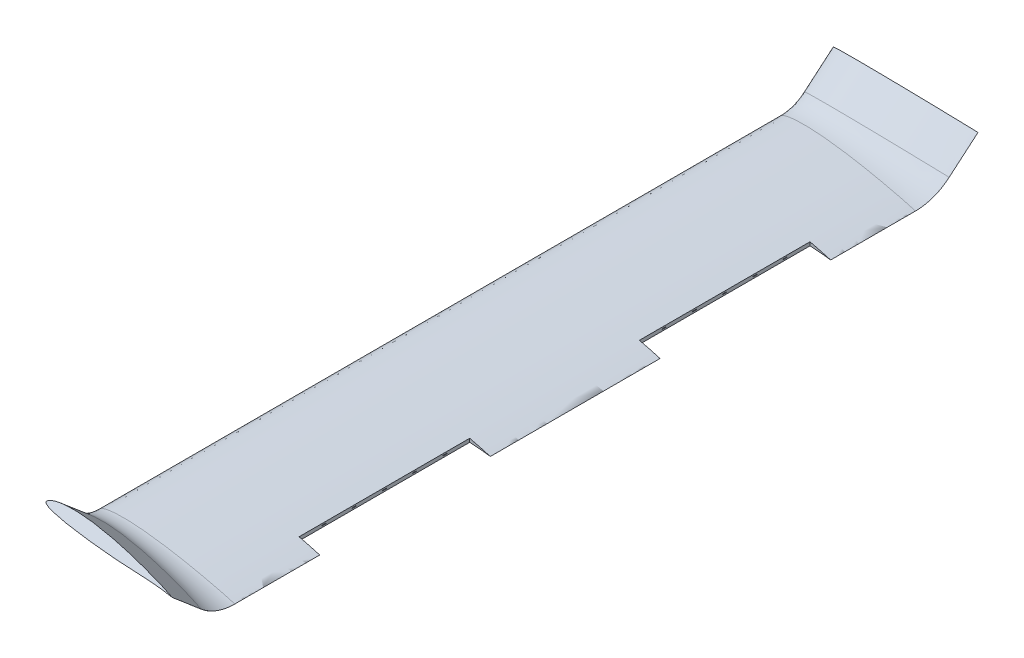
from build123d import *
from OCP.BRepFilletAPI import BRepFilletAPI_MakeChamfer

# Parameters (mm, degrees)
BOSS_EXTRUDE1_DEPTH      = 450
BOSS_EXTRUDE1_DEPTH_BACK = 450
SKETCH7_W                = 46
SKETCH7_H                = 15.25
CUT_EXTRUDE1_DEPTH       = 556.603168085
SKETCH8_W                = 15.25
SKETCH8_H                = 5.012005762
CUT_EXTRUDE2_DEPTH       = 553.051765804
CUT_EXTRUDE3_DEPTH       = 45
CUT_EXTRUDE4_DEPTH       = 410
CUT_EXTRUDE5_REACH       = 557.603
SKETCH12_W               = 10.5
SKETCH12_H               = 15.25
CUT_EXTRUDE6_DEPTH       = 455
CUT_EXTRUDE6_DEPTH_BACK  = 455
SKETCH13_R               = 4.2
FILLET1_R                = 0.5
CUT_EXTRUDE7_DEPTH       = 556.603168085
CUT_EXTRUDE7_DEPTH_BACK  = 556.603168085
SKETCH14_W               = 27.3
SKETCH14_H               = 225.6
SKETCH15_W               = 5.3
SKETCH15_H               = 0.8
CUT_EXTRUDE8_DEPTH       = 5
CHAMFER1_SIZE            = 1
CHAMFER1_SIZE2           = 1.025988033
CHAMFER1_SIZE2_2         = 0.975891742


with BuildPart() as part:
    # Sketch2 → Boss-Extrude1 (new, two sides: drawn at the far end of the back side and taken through both)
    with BuildSketch(Plane.XY.offset(-BOSS_EXTRUDE1_DEPTH_BACK)):
        with BuildLine():
            add(Edge.make_bspline(
                [(149.178284305, -15.67926949), (149.178100088, -15.669367897), (147.969720062, -15.365129532), (146.781212521, -14.96808228), (143.973138361, -14.129466561), (140.57824078, -13.14893301), (136.179599698, -11.993965641), (131.008524772, -10.676326471), (125.062627189, -9.211057383), (118.441379392, -7.629208191), (111.219090084, -5.959420593), (103.483361024, -4.236109616), (95.320944158, -2.490170431), (86.823546131, -0.756170376), (78.082093576, 0.93484848), (69.188874086, 2.546378502), (60.23609679, 4.055486477), (51.314103463, 5.426097975), (42.511619605, 6.638507249), (33.9137468, 7.666742574), (25.60204064, 8.494293884), (17.653403709, 9.108521389), (10.138891859, 9.496544193), (3.124460658, 9.657060571), (-3.330272347, 9.589478416), (-9.171265568, 9.303526434), (-14.352318755, 8.816488363), (-18.829542737, 8.142995831), (-22.577336577, 7.31366425), (-25.554758519, 6.350234274), (-27.795313367, 5.307994748), (-29.16719222, 4.271237126), (-29.815967116, 3.454528323), (-29.864327941, 2.722793442), (-29.176720523, 1.826746536), (-27.571764558, 0.948321735), (-25.071050204, -0.087774052), (-21.685377357, -1.078096294), (-17.421048183, -2.074121831), (-12.313401565, -3.043921757), (-6.405460242, -3.991552243), (0.242066464, -4.915283261), (7.560361175, -5.812060128), (15.468315998, -6.679827586), (23.876738055, -7.519541187), (32.689887896, -8.32467283), (41.805166138, -9.090480373), (51.115494147, -9.80968575), (60.510974417, -10.469411957), (69.903653192, -11.03930313), (79.229367647, -11.452191131), (88.419693103, -11.77216517), (97.381128622, -12.076327561), (105.992890974, -12.392193432), (114.126184351, -12.743108757), (121.652964529, -13.131619938), (128.46066401, -13.560315419), (134.413926302, -14.006509107), (139.488067698, -14.472383202), (143.391598904, -14.872303341), (146.576107305, -15.290479729), (147.892789649, -15.44633705), (149.178472526, -15.689386272), (149.178284305, -15.67926949)],
                knots=[0, 0, 0, 0, 0.001647855, 0.00639797, 0.013891012, 0.02387363, 0.036300541, 0.051055399, 0.067934584, 0.086711274, 0.107143554, 0.128994228, 0.151997212, 0.175901832, 0.200433657, 0.225338999, 0.25035167, 0.275220962, 0.299693913, 0.323543982, 0.346546994, 0.368495779, 0.38921046, 0.408523229, 0.426283737, 0.442372965, 0.456684004, 0.469130373, 0.479655722, 0.488244498, 0.494928047, 0.499768593, 0.502616034, 0.502853482, 0.505768125, 0.510839244, 0.518186578, 0.527884675, 0.539915214, 0.554232386, 0.570707116, 0.58919828, 0.609515424, 0.63144084, 0.65473038, 0.679124011, 0.704341366, 0.730082087, 0.756046369, 0.781927334, 0.80759466, 0.832940152, 0.857679173, 0.881457364, 0.903928672, 0.924735814, 0.943553458, 0.960078251, 0.974032381, 0.985177833, 0.993329719, 0.998316333, 1, 1, 1, 1], degree=3))
        make_face()
    extrude(amount=BOSS_EXTRUDE1_DEPTH + BOSS_EXTRUDE1_DEPTH_BACK)

    # Sweep1: sweep along a path in Sketch5
    with BuildLine(Plane(origin=(-29.835656861, 0, 0), x_dir=(0, 0, -1), z_dir=(1, 0, 0))) as sweep1_path:
        Line((-520.472468555, 47.336614657), (-482.336614657, 15))
        ThreePointArc((-482.336614657, 15), (-467.222184937, 6.195504961), (-450, 3.135853775))
    # Sketch4 → Sweep1 (sweep)
    with BuildSketch(Plane.XY.offset(450)):
        with BuildLine():
            add(Edge.make_bspline(
                [(149.178284305, -15.67926949), (149.178100088, -15.669367897), (147.969720062, -15.365129532), (146.781212521, -14.96808228), (143.973138361, -14.129466561), (140.57824078, -13.14893301), (136.179599698, -11.993965641), (131.008524772, -10.676326471), (125.062627189, -9.211057383), (118.441379392, -7.629208191), (111.219090084, -5.959420593), (103.483361024, -4.236109616), (95.320944158, -2.490170431), (86.823546131, -0.756170376), (78.082093576, 0.93484848), (69.188874086, 2.546378502), (60.23609679, 4.055486477), (51.314103463, 5.426097975), (42.511619605, 6.638507249), (33.9137468, 7.666742574), (25.60204064, 8.494293884), (17.653403709, 9.108521389), (10.138891859, 9.496544193), (3.124460658, 9.657060571), (-3.330272347, 9.589478416), (-9.171265568, 9.303526434), (-14.352318755, 8.816488363), (-18.829542737, 8.142995831), (-22.577336577, 7.31366425), (-25.554758519, 6.350234274), (-27.795313367, 5.307994748), (-29.16719222, 4.271237126), (-29.815967116, 3.454528323), (-29.864327941, 2.722793442), (-29.176720523, 1.826746536), (-27.571764558, 0.948321735), (-25.071050204, -0.087774052), (-21.685377357, -1.078096294), (-17.421048183, -2.074121831), (-12.313401565, -3.043921757), (-6.405460242, -3.991552243), (0.242066464, -4.915283261), (7.560361175, -5.812060128), (15.468315998, -6.679827586), (23.876738055, -7.519541187), (32.689887896, -8.32467283), (41.805166138, -9.090480373), (51.115494147, -9.80968575), (60.510974417, -10.469411957), (69.903653192, -11.03930313), (79.229367647, -11.452191131), (88.419693103, -11.77216517), (97.381128622, -12.076327561), (105.992890974, -12.392193432), (114.126184351, -12.743108757), (121.652964529, -13.131619938), (128.46066401, -13.560315419), (134.413926302, -14.006509107), (139.488067698, -14.472383202), (143.391598904, -14.872303341), (146.576107305, -15.290479729), (147.892789649, -15.44633705), (149.178472526, -15.689386272), (149.178284305, -15.67926949)],
                knots=[0, 0, 0, 0, 0.001647855, 0.00639797, 0.013891012, 0.02387363, 0.036300541, 0.051055399, 0.067934584, 0.086711274, 0.107143554, 0.128994228, 0.151997212, 0.175901832, 0.200433657, 0.225338999, 0.25035167, 0.275220962, 0.299693913, 0.323543982, 0.346546994, 0.368495779, 0.38921046, 0.408523229, 0.426283737, 0.442372965, 0.456684004, 0.469130373, 0.479655722, 0.488244498, 0.494928047, 0.499768593, 0.502616034, 0.502853482, 0.505768125, 0.510839244, 0.518186578, 0.527884675, 0.539915214, 0.554232386, 0.570707116, 0.58919828, 0.609515424, 0.63144084, 0.65473038, 0.679124011, 0.704341366, 0.730082087, 0.756046369, 0.781927334, 0.80759466, 0.832940152, 0.857679173, 0.881457364, 0.903928672, 0.924735814, 0.943553458, 0.960078251, 0.974032381, 0.985177833, 0.993329719, 0.998316333, 1, 1, 1, 1], degree=3))
        make_face()
    sweep1 = sweep(path=sweep1_path.line)

    # Mirror1: Sweep1 across plane
    add(sweep1.mirror(Plane.XY))

    # Sketch7 → Cut-Extrude1 (cut, through all)
    with BuildSketch(Plane(origin=(0, 0, 0), x_dir=(-0.9945218953682733, 0.1045284632676537, 0), z_dir=(-0.1045284632676537, -0.9945218953682733, 0))):
        with Locations((-37.5, 0)):
            Rectangle(SKETCH7_W, SKETCH7_H)
    extrude(amount=CUT_EXTRUDE1_DEPTH, mode=Mode.SUBTRACT)

    # Sketch8 → Cut-Extrude2 (cut, through all)
    with BuildSketch(Plane(origin=(14.420567483, -1.515662717, 0), x_dir=(0, 0, -1), z_dir=(0.9945218953682733, -0.1045284632676537, 0))):
        with Locations((0, -2.506002881)):
            Rectangle(SKETCH8_W, SKETCH8_H)
    extrude(amount=-CUT_EXTRUDE2_DEPTH, mode=Mode.SUBTRACT)

    # Sketch10 → Cut-Extrude3 (cut)
    with BuildSketch(Plane.XY.offset(250)):
        with BuildLine():
            Line((22.642029634, 4.666350594), (21.686637625, -7.2955567))
            add(Edge.make_bspline(
                [(21.686637625, -7.2955567), (22.372513458, -7.362627677), (26.005981902, -7.71405979), (32.689887896, -8.32467283), (41.805166138, -9.090480373), (51.115494147, -9.80968575), (58.552866029, -10.331918675), (62.875024153, -10.607020076), (64.051725957, -10.679236733)],
                knots=[0.649053498, 0.649053498, 0.649053498, 0.649053498, 0.65473038, 0.679124011, 0.704341366, 0.730082087, 0.756046369, 0.765757673, 0.765757673, 0.765757673, 0.765757673], degree=3))
            Line((64.051725957, -10.679236733), (65.007117967, 1.282670561))
            Line((65.007117967, 1.282670561), (22.642029634, 4.666350594))
        make_face()
    cut_extrude3 = extrude(amount=-CUT_EXTRUDE3_DEPTH, mode=Mode.SUBTRACT)

    # Mirror2: Cut-Extrude3 across plane
    add(cut_extrude3.mirror(Plane.XY), mode=Mode.SUBTRACT)

    # Sketch11 → Cut-Extrude4 (cut)
    with BuildSketch(Plane.XY.offset(205)):
        Polygon((48.400263436, 0.602683358), (63.352647553, -0.591556654), (63.03418355, -4.578859085), (48.081799433, -3.384619073), align=None)
    extrude(amount=-CUT_EXTRUDE4_DEPTH, mode=Mode.SUBTRACT)

    # Cut-Extrude5: up to this plane
    cut_extrude5_end = Plane(origin=(48.400263436, 0.602683358, -205), z_dir=(-0.07961600076933928, -0.9968256078279172, 0))
    # Sketch12 → Cut-Extrude5 (cut, up to the surface)
    with BuildSketch(Plane(origin=(0, 0, 0), x_dir=(0.9945218953682733, -0.10452846326765369, 0), z_dir=(-0.10452846326765369, -0.9945218953682733, 0)), mode=Mode.PRIVATE) as cut_extrude5_sk1:
        with Locations((55.25, 0)):
            Rectangle(SKETCH12_W, SKETCH12_H)
    cut_extrude5_tool1 = split(extrude(cut_extrude5_sk1.sketch, amount=-CUT_EXTRUDE5_REACH, mode=Mode.PRIVATE), bisect_by=cut_extrude5_end, keep=Keep.BOTH, mode=Mode.PRIVATE)
    add(cut_extrude5_tool1.solids().sort_by_distance((54.947335, -5.775198, 0))[0], mode=Mode.SUBTRACT)

    # Sketch13 → Cut-Extrude6 (cut, two sides: drawn at the far end of the back side and taken through both)
    with BuildSketch(Plane.XY.offset(-CUT_EXTRUDE6_DEPTH_BACK)):
        with Locations((74.891913822, -5.35769175)):
            Circle(SKETCH13_R)
        Polygon((10.154275774, 0.94375722), (4.783857566, 1.508211182), (5.348311528, 6.87862939), (10.718729736, 6.314175428), align=None)
    extrude(amount=CUT_EXTRUDE6_DEPTH + CUT_EXTRUDE6_DEPTH_BACK, mode=Mode.SUBTRACT)

    # Fillet1
    fillet1_edges = [part.edges().sort_by_distance(p)[0] for p in [
        (-29.835656861, 3.135853898, 3.8125),
    ]]
    fillet(fillet1_edges, radius=FILLET1_R)

    # Sketch14 → Cut-Extrude7 (cut, two sides: drawn at the far end of the back side and taken through both)
    with BuildSketch(Plane(origin=(0, 0, 0), x_dir=(1, 0, 0), z_dir=(0, 1, 0)).offset(-CUT_EXTRUDE7_DEPTH_BACK)):
        with Locations((135.528284387, 225)):
            Rectangle(SKETCH14_W, SKETCH14_H)
        with Locations((135.528284387, -225)):
            Rectangle(SKETCH14_W, SKETCH14_H)
    extrude(amount=CUT_EXTRUDE7_DEPTH + CUT_EXTRUDE7_DEPTH_BACK, mode=Mode.SUBTRACT)

    # Sketch15 → Cut-Extrude8 (cut)
    with BuildSketch(Plane(origin=(121.878284387, 0, 0), x_dir=(0, 0, -1), z_dir=(1, 0, 0))):
        with Locations((-185, -10.80530918)):
            Rectangle(SKETCH15_W, SKETCH15_H)
        with Locations((-225, -10.80530918)):
            Rectangle(SKETCH15_W, SKETCH15_H)
        with Locations((-145, -10.80530918)):
            Rectangle(SKETCH15_W, SKETCH15_H)
        with Locations((-265, -10.80530918)):
            Rectangle(SKETCH15_W, SKETCH15_H)
        with Locations((-305, -10.80530918)):
            Rectangle(SKETCH15_W, SKETCH15_H)
        with Locations((305, -10.80530918)):
            Rectangle(SKETCH15_W, SKETCH15_H)
        with Locations((265, -10.80530918)):
            Rectangle(SKETCH15_W, SKETCH15_H)
        with Locations((145, -10.80530918)):
            Rectangle(SKETCH15_W, SKETCH15_H)
        with Locations((185, -10.80530918)):
            Rectangle(SKETCH15_W, SKETCH15_H)
        with Locations((225, -10.80530918)):
            Rectangle(SKETCH15_W, SKETCH15_H)
    extrude(amount=-CUT_EXTRUDE8_DEPTH, mode=Mode.SUBTRACT)

    # Chamfer1: one chamfer whose edges measure the first distance from different faces: ONE call of the kernel's chamfer builder (chamfer() names one face for all edges)
    chamfer1_edges_1 = [part.edges().sort_by_distance(p)[0] for p in [
        (55.139349151, -3.948302309, -7.625),
        (55.139349151, -3.948302309, 7.625),
    ]]
    chamfer1_edges_2 = [part.edges().sort_by_distance(p)[0] for p in [
        (60.374321976, -4.36641717, 0),
    ]]
    chamfer1_side_2 = [part.faces().sort_by_distance(p)[0] for p in [
        (60.057052286, -7.385036636, 0),
    ]]
    chamfer1_edges_3 = [part.edges().sort_by_distance(p)[0] for p in [
        (49.904376326, -3.530187448, 0),
    ]]
    chamfer1_side_3 = [part.faces().sort_by_distance(p)[0] for p in [
        (49.815235547, -4.378305306, 0),
    ]]
    chamfer1 = BRepFilletAPI_MakeChamfer(part.part.solid().wrapped)
    for e in chamfer1_edges_1:
        chamfer1.Add(CHAMFER1_SIZE, e.wrapped)
    for e in chamfer1_edges_2:
        chamfer1.Add(CHAMFER1_SIZE, CHAMFER1_SIZE2, e.wrapped, chamfer1_side_2[0].wrapped)  # the first distance lies on this face
    for e in chamfer1_edges_3:
        chamfer1.Add(CHAMFER1_SIZE, CHAMFER1_SIZE2_2, e.wrapped, chamfer1_side_3[0].wrapped)  # the first distance lies on this face
    add(Compound.cast(chamfer1.Shape()), mode=Mode.REPLACE)


solid = part.part
